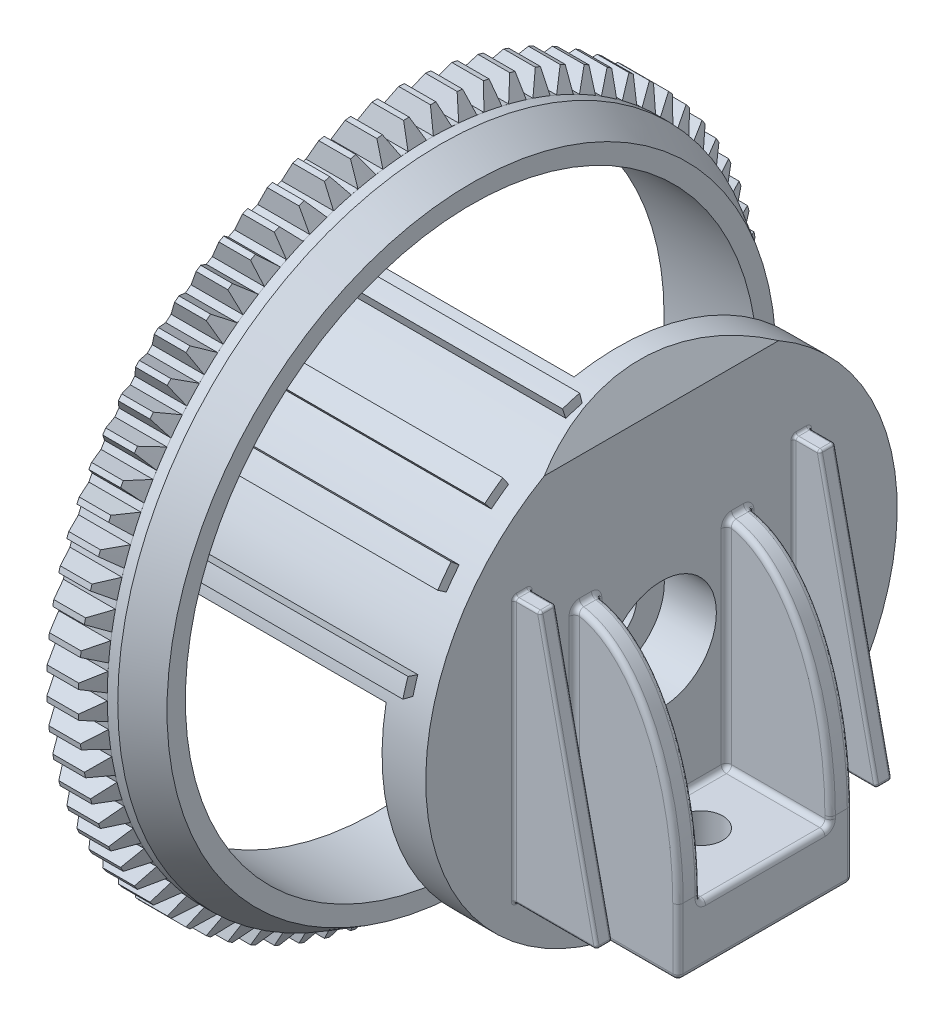
from build123d import *
from build123d.topology import SkipClean

# Parameters (mm, degrees)
SKETCH1_R               = 22.65
BOSS_EXTRUDE1_DEPTH     = 4.2
SKETCH2_R               = 20.05
CUT_EXTRUDE1_DEPTH      = 2.25
FILLET1_R               = 0.3
SKETCH4_R               = 7.5
BOSS_EXTRUDE3_DEPTH     = 17.45
FILLET2_R               = 2
SKETCH5_R               = 5.55
CUT_EXTRUDE3_DEPTH      = 12.26
SKETCH3_R               = 2.625
CUT_EXTRUDE2_DEPTH      = 11.25
SKETCH6_R               = 5.275
CUT_EXTRUDE5_DEPTH      = 5
BOSS_EXTRUDE4_START     = 12.26
BOSS_EXTRUDE4_DEPTH     = 12.26
BOSS_EXTRUDE5_DEPTH     = 9.97
FILLET3_START           = -8.385
FILLET3_DEPTH           = 16.77
SKETCH9_R               = 2.045
CUT_EXTRUDE6_DEPTH      = 9.97
FILLET4_R               = 0.5
CUT_EXTRUDE7_DEPTH      = 19.97
CUT_EXTRUDE7_DEPTH_BACK = 19.97
BOSS_EXTRUDE6_START     = 20.3
BOSS_EXTRUDE6_DEPTH     = 20.3
SKETCH12_W              = 1.5
SKETCH12_H              = 25.4
BOSS_EXTRUDE7_DEPTH     = 8
CUT_EXTRUDE8_DEPTH      = 4
FILLET5_R               = 0.25
BOSS_EXTRUDE8_START     = 5
BOSS_EXTRUDE8_DEPTH     = 5
SKETCH24_R              = 30.997182168
SKETCH24_R_2            = 27.5
BOSS_EXTRUDE9_DEPTH     = 4
CHAMFER1_SIZE           = 3
CHAMFER1_SIZE2          = 1.732050808


with BuildPart() as part:
    # Sketch1 → Boss-Extrude1 (new body)
    with BuildSketch(Plane(origin=(0, 0, 0), x_dir=(0, 0, -1), z_dir=(1, 0, 0))):
        Circle(SKETCH1_R)
    extrude(amount=BOSS_EXTRUDE1_DEPTH)

    # Sketch2 → Cut-Extrude1 (cut)
    with BuildSketch(Plane.ZY):
        Circle(SKETCH2_R)
    extrude(amount=-CUT_EXTRUDE1_DEPTH, mode=Mode.SUBTRACT)

    # Fillet1
    fillet1_edges = [part.edges().sort_by_distance(p)[0] for p in [
        (2.25, 0, -20.05),
        (0, 0, -20.05),
    ]]
    fillet(fillet1_edges, radius=FILLET1_R)

    # Sketch4 → Boss-Extrude3 (add)
    with BuildSketch(Plane.ZY.offset(-2.25)):
        Circle(SKETCH4_R)
    extrude(amount=BOSS_EXTRUDE3_DEPTH)

    # Fillet2
    fillet2_edges = [part.edges().sort_by_distance(p)[0] for p in [
        (2.25, 0, -7.5),
    ]]
    fillet(fillet2_edges, radius=FILLET2_R)

    # Sketch5 → Cut-Extrude3 (cut)
    with BuildSketch(Plane.ZY.offset(15.2)):
        Circle(SKETCH5_R)
    extrude(amount=-CUT_EXTRUDE3_DEPTH, mode=Mode.SUBTRACT)

    # Sketch3 → Cut-Extrude2 (cut)
    with BuildSketch(Plane(origin=(4.2, 0, 0), x_dir=(0, 0, -1), z_dir=(1, 0, 0))):
        Circle(SKETCH3_R)
    extrude(amount=-CUT_EXTRUDE2_DEPTH, mode=Mode.SUBTRACT)

    # Sketch6 → Cut-Extrude5 (cut)
    with BuildSketch(Plane(origin=(4.2, 0, 0), x_dir=(0, 0, -1), z_dir=(1, 0, 0))):
        Circle(SKETCH6_R)
    extrude(amount=-CUT_EXTRUDE5_DEPTH, mode=Mode.SUBTRACT)

    # Sketch7 → Boss-Extrude4 (add)
    with BuildSketch(Plane.ZY.offset(2.94).offset(BOSS_EXTRUDE4_START)):
        with BuildLine():
            Line((-2.698147513, -4.85), (2.698147513, -4.85))
            ThreePointArc((2.698147513, -4.85), (0, -5.55), (-2.698147513, -4.85))
        make_face()
        with BuildLine():
            Line((2.698147513, 4.85), (-2.698147513, 4.85))
            ThreePointArc((-2.698147513, 4.85), (0, 5.55), (2.698147513, 4.85))
        make_face()
    extrude(amount=-BOSS_EXTRUDE4_DEPTH)

    # Sketch8 → Boss-Extrude5 (add)
    with BuildSketch(Plane(origin=(4.2, 0, 0), x_dir=(0, 0, -1), z_dir=(1, 0, 0))):
        Polygon((8.385, -18.97), (-8.385, -18.97), (-8.385, 7.34), (-6.235, 7.34), (-6.235, -13.37), (6.235, -13.37), (6.235, 7.34), (8.385, 7.34), align=None)
    extrude(amount=BOSS_EXTRUDE5_DEPTH)

    # Fillet3: read off the stored shape, not the designer's step
    # Fillet3 outline → Fillet3 (cut)
    with BuildSketch(Plane.XY.offset(FILLET3_START)):
        with BuildLine():
            Line((14.17, 7.34), (4.2, 7.34))
            add(Edge.make_bspline(
                [(4.2, 7.34), (14.17, 6.575053386), (14.17, -12.601391626)],
                knots=[0, 0, 0, 1, 1, 1], degree=2, weights=[1, 0.733655232, 1]))
            Line((14.17, -12.601391626), (14.17, 7.34))
        make_face()
    extrude(amount=FILLET3_DEPTH, mode=Mode.SUBTRACT)

    # Sketch9 → Cut-Extrude6 (cut)
    with BuildSketch(Plane.XZ.offset(18.97)):
        with Locations(Location((8.035, 0, 0), (0, 0, 270))):
            Circle(SKETCH9_R)
    extrude(amount=-CUT_EXTRUDE6_DEPTH, mode=Mode.SUBTRACT)

    # Fillet4
    fillet4_edges = [part.edges().sort_by_distance(p)[0] for p in [
        (4.2, 7.34, -7.31),
        (4.2, -18.97, 0),
        (4.2, 7.34, 7.31),
        (9.185, -13.37, 6.235),
        (12.196725877, -0.808020122, 6.235),
        (4.2, -3.015, 6.235),
        (9.185, -13.37, -6.235),
        (4.2, -3.015, -6.235),
        (12.196725877, -0.808020122, -6.235),
        (9.185, -18.97, -8.385),
        (12.196714654, -0.807990396, -8.385),
        (4.2, -5.815, -8.385),
        (9.185, -18.97, 8.385),
        (4.2, -5.815, 8.385),
        (12.196714654, -0.807990396, 8.385),
        (14.17, -18.97, 0),
        (14.17, -15.785695813, 8.385),
        (14.17, -12.985695813, 6.235),
        (14.17, -13.37, 0),
        (14.17, -12.985695813, -6.235),
        (14.17, -15.785695813, -8.385),
        (4.2, -13.37, 0),
    ]]
    fillet(fillet4_edges, radius=FILLET4_R)

    # Sketch10 → Cut-Extrude7 (cut, two sides: drawn at the far end of the back side and taken through both)
    with BuildSketch(Plane.XY.offset(-CUT_EXTRUDE7_DEPTH_BACK)):
        Polygon((4.2, 22.65), (4.2, 19.65), (2.1, 22.65), align=None)
    extrude(amount=CUT_EXTRUDE7_DEPTH + CUT_EXTRUDE7_DEPTH_BACK, mode=Mode.SUBTRACT)

    # Sketch11 → Boss-Extrude6 (add)
    with SkipClean():  # the faces are left unmerged after this step: merging them gives an invalid solid
        with BuildSketch(Plane.ZY.offset(-2.25).offset(BOSS_EXTRUDE6_START)):
            with BuildLine():
                Line((21.930213837, 5.664646596), (22.898435199, 5.914741368))
                ThreePointArc((22.898435199, 5.914741368), (22.668143265, 6.743721592), (22.407850884, 7.563776751))
                Line((22.407850884, 7.563776751), (21.460373046, 7.243955324))
                ThreePointArc((21.460373046, 7.243955324), (20.279979501, 10.086869258), (18.725016199, 12.743479444))
                Line((18.725016199, 12.743479444), (19.551727731, 13.306105468))
                ThreePointArc((19.551727731, 13.306105468), (18.925107529, 14.183187407), (18.259172679, 15.03080547))
                Line((18.259172679, 15.03080547), (17.487114637, 14.395253442))
                ThreePointArc((17.487114637, 14.395253442), (16.015968594, 16.015968594), (14.395253442, 17.487114637))
                Line((14.395253442, 17.487114637), (15.03080547, 18.259172679))
                ThreePointArc((15.03080547, 18.259172679), (14.183187407, 18.925107529), (13.306105468, 19.551727731))
                Line((13.306105468, 19.551727731), (12.743479444, 18.725016199))
                ThreePointArc((12.743479444, 18.725016199), (10.086869258, 20.279979501), (7.243955324, 21.460373046))
                Line((7.243955324, 21.460373046), (7.563776751, 22.407850884))
                ThreePointArc((7.563776751, 22.407850884), (6.743721592, 22.668143265), (5.914741368, 22.898435199))
                Line((5.914741368, 22.898435199), (5.664646596, 21.930213837))
                ThreePointArc((5.664646596, 21.930213837), (4.935032061, 22.105835396), (4.2, 22.25718985))
                Line((4.2, 22.25718985), (3.272847682, 17.343902907))
                ThreePointArc((3.272847682, 17.343902907), (12.480434688, 12.480434688), (17.343902907, 3.272847682))
                Line((17.343902907, 3.272847682), (22.25718985, 4.2))
                ThreePointArc((22.25718985, 4.2), (22.105835396, 4.935032061), (21.930213837, 5.664646596))
            make_face()
        extrude(amount=-BOSS_EXTRUDE6_DEPTH)
    add(part.part.scale(1), mode=Mode.REPLACE)  # the faces are merged on a copy

    # Sketch12 → Boss-Extrude7 (add)
    with BuildSketch(Plane(origin=(4.2, 0, 0), x_dir=(0, 0, -1), z_dir=(1, 0, 0))):
        with Locations((13.435, -1.712172826)):
            Rectangle(SKETCH12_W, SKETCH12_H)
    boss_extrude7 = extrude(amount=BOSS_EXTRUDE7_DEPTH)

    # Sketch13 → Cut-Extrude8 (cut)
    with BuildSketch(Plane(origin=(0, 0, -14.185), x_dir=(-1, 0, 0), z_dir=(0, 0, -1))):
        Polygon((-6.7, 10.987827174), (-12.2, -14.412172826), (-12.2, 10.987827174), align=None)
    cut_extrude8 = extrude(amount=-CUT_EXTRUDE8_DEPTH, mode=Mode.SUBTRACT)

    # Mirror1: Boss-Extrude7, Cut-Extrude8 across plane
    add(boss_extrude7.mirror(Plane.XY))
    add(cut_extrude8.mirror(Plane.XY), mode=Mode.SUBTRACT)

    # Fillet5
    fillet5_edges = [part.edges().sort_by_distance(p)[0] for p in [
        (4.2, -14.412172826, -13.435),
        (8.2, -14.412172826, -12.685),
        (4.2, -1.712172826, -14.185),
        (8.2, -14.412172826, -14.185),
        (4.2, 10.987827174, -13.435),
        (4.2, -1.712172826, -12.685),
        (12.2, -14.412172826, -13.435),
        (5.45, 10.987827174, -12.685),
        (5.45, 10.987827174, -14.185),
        (9.45, -1.712172826, -12.685),
        (6.7, 10.987827174, -13.435),
        (9.45, -1.712172826, -14.185),
        (12.2, -14.412172826, 13.435),
        (8.2, -14.412172826, 14.185),
        (8.2, -14.412172826, 12.685),
        (4.2, -14.412172826, 13.435),
        (4.2, -1.712172826, 14.185),
        (4.2, 10.987827174, 13.435),
        (4.2, -1.712172826, 12.685),
        (5.45, 10.987827174, 14.185),
        (5.45, 10.987827174, 12.685),
        (6.7, 10.987827174, 13.435),
        (9.45, -1.712172826, 12.685),
        (9.45, -1.712172826, 14.185),
    ]]
    fillet(fillet5_edges, radius=FILLET5_R)

    # Sketch14 → Boss-Extrude8 (add)
    with SkipClean():  # the faces are left unmerged after this step: merging them gives an invalid solid
        with BuildSketch(Plane.ZY.offset(18.05).offset(BOSS_EXTRUDE8_START)):
            Polygon((-29.376333174, 9.897931615), (-30.863257239, 11.104024162), (-30.680091743, 11.600515964), (-28.766131363, 11.551955999), (-28.509192978, 12.172260132), (-29.896904422, 13.491297415), (-29.675349267, 13.9718877), (-27.771098959, 13.773309829), (-27.466284128, 14.371542617), (-28.746227248, 15.795392334), (-28.487648394, 16.257118102), (-26.604848494, 15.909746623), (-26.254036502, 16.482219763), (-27.418320024, 18.002103406), (-27.124311696, 18.442117965), (-25.274570292, 17.948094538), (-24.879924011, 18.491278544), (-25.921369739, 20.097825525), (-25.593744596, 20.513416038), (-23.788465959, 19.875786483), (-23.352418516, 20.386332443), (-24.26460559, 22.069637866), (-23.905383551, 22.458242079), (-22.155697823, 21.680937594), (-21.680937594, 22.155697823), (-22.458242079, 23.905383551), (-22.069637866, 24.26460559), (-20.386332443, 23.352418516), (-19.875786483, 23.788465959), (-20.513416038, 25.593744596), (-20.097825525, 25.921369739), (-18.491278544, 24.879924011), (-17.948094538, 25.274570292), (-18.442117965, 27.124311696), (-18.002103406, 27.418320024), (-16.482219763, 26.254036502), (-15.909746623, 26.604848494), (-16.257118102, 28.487648394), (-15.795392334, 28.746227248), (-14.371542617, 27.466284128), (-13.773309829, 27.771098959), (-13.9718877, 29.675349267), (-13.491297415, 29.896904422), (-12.172260132, 28.509192978), (-11.551955999, 28.766131363), (-11.600515964, 30.680091743), (-11.104024162, 30.863257239), (-9.897931615, 29.376333174), (-9.25938052, 29.583811002), (-9.15762319, 31.495681252), (-8.648290907, 31.639327812), (-7.562579059, 30.062358507), (-6.909717881, 30.219096608), (-6.658270623, 32.117089412), (-6.139238063, 32.220331407), (-5.180600688, 30.563039402), (-4.517454533, 30.668071435), (-4.117867604, 32.540485036), (-3.592334775, 32.602685946), (-2.76668219, 30.875288997), (-2.097339576, 30.927967403), (-1.552076562, 32.763257749), (-1.023283548, 32.784034083), (-0.335706178, 30.997182168), (0.335706178, 30.997182168), (1.023283548, 32.784034083), (1.552076562, 32.763257749), (2.097339576, 30.927967403), (2.76668219, 30.875288997), (3.592334775, 32.602685946), (4.117867604, 32.540485036), (4.517454533, 30.668071435), (5.180600688, 30.563039402), (6.139238063, 32.220331407), (6.658270623, 32.117089412), (6.909717881, 30.219096608), (7.562579059, 30.062358507), (8.648290907, 31.639327812), (9.15762319, 31.495681252), (9.25938052, 29.583811002), (9.897931615, 29.376333174), (11.104024162, 30.863257239), (11.600515964, 30.680091743), (11.551955999, 28.766131363), (12.172260132, 28.509192978), (13.491297415, 29.896904422), (13.9718877, 29.675349267), (13.773309829, 27.771098959), (14.371542617, 27.466284128), (15.795392334, 28.746227248), (16.257118102, 28.487648394), (15.909746623, 26.604848494), (16.482219763, 26.254036502), (18.002103406, 27.418320024), (18.442117965, 27.124311696), (17.948094538, 25.274570292), (18.491278544, 24.879924011), (20.097825525, 25.921369739), (20.513416038, 25.593744596), (19.875786483, 23.788465959), (20.386332443, 23.352418516), (22.069637866, 24.26460559), (22.458242079, 23.905383551), (21.680937594, 22.155697823), (22.155697823, 21.680937594), (23.905383551, 22.458242079), (24.26460559, 22.069637866), (23.352418516, 20.386332443), (23.788465959, 19.875786483), (25.593744596, 20.513416038), (25.921369739, 20.097825525), (24.879924011, 18.491278544), (25.274570292, 17.948094538), (27.124311696, 18.442117965), (27.418320024, 18.002103406), (26.254036502, 16.482219763), (26.604848494, 15.909746623), (28.487648394, 16.257118102), (28.746227248, 15.795392334), (27.466284128, 14.371542617), (27.771098959, 13.773309829), (29.675349267, 13.9718877), (29.896904422, 13.491297415), (28.509192978, 12.172260132), (28.766131363, 11.551955999), (30.680091743, 11.600515964), (30.863257239, 11.104024162), (29.376333174, 9.897931615), (29.583811002, 9.25938052), (31.495681252, 9.15762319), (31.639327812, 8.648290907), (30.062358507, 7.562579059), (30.219096608, 6.909717881), (32.117089412, 6.658270623), (32.220331407, 6.139238063), (30.563039402, 5.180600688), (30.668071435, 4.517454533), (32.540485036, 4.117867604), (32.602685946, 3.592334775), (30.875288997, 2.76668219), (30.927967403, 2.097339576), (32.763257749, 1.552076562), (32.784034083, 1.023283548), (30.997182168, 0.335706178), (30.997182168, -0.335706178), (32.784034083, -1.023283548), (32.763257749, -1.552076562), (30.927967403, -2.097339576), (30.875288997, -2.76668219), (32.602685946, -3.592334775), (32.540485036, -4.117867604), (30.668071435, -4.517454533), (30.563039402, -5.180600688), (32.220331407, -6.139238063), (32.117089412, -6.658270623), (30.219096608, -6.909717881), (30.062358507, -7.562579059), (31.639327812, -8.648290907), (31.495681252, -9.15762319), (29.583811002, -9.25938052), (29.376333174, -9.897931615), (30.863257239, -11.104024162), (30.680091743, -11.600515964), (28.766131363, -11.551955999), (28.509192978, -12.172260132), (29.896904422, -13.491297415), (29.675349267, -13.9718877), (27.771098959, -13.773309829), (27.466284128, -14.371542617), (28.746227248, -15.795392334), (28.487648394, -16.257118102), (26.604848494, -15.909746623), (26.254036502, -16.482219763), (27.418320024, -18.002103406), (27.124311696, -18.442117965), (25.274570292, -17.948094538), (24.879924011, -18.491278544), (25.921369739, -20.097825525), (25.593744596, -20.513416038), (23.788465959, -19.875786483), (23.352418516, -20.386332443), (24.26460559, -22.069637866), (23.905383551, -22.458242079), (22.155697823, -21.680937594), (21.680937594, -22.155697823), (22.458242079, -23.905383551), (22.069637866, -24.26460559), (20.386332443, -23.352418516), (19.875786483, -23.788465959), (20.513416038, -25.593744596), (20.097825525, -25.921369739), (18.491278544, -24.879924011), (17.948094538, -25.274570292), (18.442117965, -27.124311696), (18.002103406, -27.418320024), (16.482219763, -26.254036502), (15.909746623, -26.604848494), (16.257118102, -28.487648394), (15.795392334, -28.746227248), (14.371542617, -27.466284128), (13.773309829, -27.771098959), (13.9718877, -29.675349267), (13.491297415, -29.896904422), (12.172260132, -28.509192978), (11.551955999, -28.766131363), (11.600515964, -30.680091743), (11.104024162, -30.863257239), (9.897931615, -29.376333174), (9.25938052, -29.583811002), (9.15762319, -31.495681252), (8.648290907, -31.639327812), (7.562579059, -30.062358507), (6.909717881, -30.219096608), (6.658270623, -32.117089412), (6.139238063, -32.220331407), (5.180600688, -30.563039402), (4.517454533, -30.668071435), (4.117867604, -32.540485036), (3.592334775, -32.602685946), (2.76668219, -30.875288997), (2.097339576, -30.927967403), (1.552076562, -32.763257749), (1.023283548, -32.784034083), (0.335706178, -30.997182168), (-0.335706178, -30.997182168), (-1.023283548, -32.784034083), (-1.552076562, -32.763257749), (-2.097339576, -30.927967403), (-2.76668219, -30.875288997), (-3.592334775, -32.602685946), (-4.117867604, -32.540485036), (-4.517454533, -30.668071435), (-5.180600688, -30.563039402), (-6.139238063, -32.220331407), (-6.658270623, -32.117089412), (-6.909717881, -30.219096608), (-7.562579059, -30.062358507), (-8.648290907, -31.639327812), (-9.15762319, -31.495681252), (-9.25938052, -29.583811002), (-9.897931615, -29.376333174), (-11.104024162, -30.863257239), (-11.600515964, -30.680091743), (-11.551955999, -28.766131363), (-12.172260132, -28.509192978), (-13.491297415, -29.896904422), (-13.9718877, -29.675349267), (-13.773309829, -27.771098959), (-14.371542617, -27.466284128), (-15.795392334, -28.746227248), (-16.257118102, -28.487648394), (-15.909746623, -26.604848494), (-16.482219763, -26.254036502), (-18.002103406, -27.418320024), (-18.442117965, -27.124311696), (-17.948094538, -25.274570292), (-18.491278544, -24.879924011), (-20.097825525, -25.921369739), (-20.513416038, -25.593744596), (-19.875786483, -23.788465959), (-20.386332443, -23.352418516), (-22.069637866, -24.26460559), (-22.458242079, -23.905383551), (-21.680937594, -22.155697823), (-22.155697823, -21.680937594), (-23.905383551, -22.458242079), (-24.26460559, -22.069637866), (-23.352418516, -20.386332443), (-23.788465959, -19.875786483), (-25.593744596, -20.513416038), (-25.921369739, -20.097825525), (-24.879924011, -18.491278544), (-25.274570292, -17.948094538), (-27.124311696, -18.442117965), (-27.418320024, -18.002103406), (-26.254036502, -16.482219763), (-26.604848494, -15.909746623), (-28.487648394, -16.257118102), (-28.746227248, -15.795392334), (-27.466284128, -14.371542617), (-27.771098959, -13.773309829), (-29.675349267, -13.9718877), (-29.896904422, -13.491297415), (-28.509192978, -12.172260132), (-28.766131363, -11.551955999), (-30.680091743, -11.600515964), (-30.863257239, -11.104024162), (-29.376333174, -9.897931615), (-29.583811002, -9.25938052), (-31.495681252, -9.15762319), (-31.639327812, -8.648290907), (-30.062358507, -7.562579059), (-30.219096608, -6.909717881), (-32.117089412, -6.658270623), (-32.220331407, -6.139238063), (-30.563039402, -5.180600688), (-30.668071435, -4.517454533), (-32.540485036, -4.117867604), (-32.602685946, -3.592334775), (-30.875288997, -2.76668219), (-30.927967403, -2.097339576), (-32.763257749, -1.552076562), (-32.784034083, -1.023283548), (-30.997182168, -0.335706178), (-30.997182168, 0.335706178), (-32.784034083, 1.023283548), (-32.763257749, 1.552076562), (-30.927967403, 2.097339576), (-30.875288997, 2.76668219), (-32.602685946, 3.592334775), (-32.540485036, 4.117867604), (-30.668071435, 4.517454533), (-30.563039402, 5.180600688), (-32.220331407, 6.139238063), (-32.117089412, 6.658270623), (-30.219096608, 6.909717881), (-30.062358507, 7.562579059), (-31.639327812, 8.648290907), (-31.495681252, 9.15762319), (-29.583811002, 9.25938052), align=None)
            with BuildLine():
                Line((17.343902907, 3.272847682), (27.023078184, 5.099337748))
                ThreePointArc((27.023078184, 5.099337748), (-19.445436483, -19.445436483), (5.099337748, 27.023078184))
                Line((5.099337748, 27.023078184), (3.272847682, 17.343902907))
                ThreePointArc((3.272847682, 17.343902907), (12.480434688, 12.480434688), (17.343902907, 3.272847682))
            make_face(mode=Mode.SUBTRACT)
        extrude(amount=-BOSS_EXTRUDE8_DEPTH)

    # Sketch21 → Cut-Revolve1 (revolve, cut)
    with SkipClean():  # the faces are left unmerged after this step: merging them gives an invalid solid
        with BuildSketch(Plane.XY, mode=Mode.PRIVATE) as cut_revolve1_sk:
            Polygon((-18.05, 30.997182168), (-19.082046592, 32.900600951), (-18.05, 32.900600951), align=None)
            Polygon((-23.05, 30.997182168), (-22.017953408, 32.900600951), (-23.05, 32.900600951), align=None)
        revolve(cut_revolve1_sk.sketch.rotate(Axis((-19.082046592, 0, 0), (1, 0, 0)), 79.31376961), axis=Axis((-19.082046592, 0, 0), (1, 0, 0)), mode=Mode.SUBTRACT)

    # Sketch24 → Boss-Extrude9 (add)
    with SkipClean():  # the faces are left unmerged after this step: merging them gives an invalid solid
        with BuildSketch(Plane(origin=(-18.05, 0, 0), x_dir=(0, 0, -1), z_dir=(1, 0, 0))):
            Circle(SKETCH24_R)
            Circle(SKETCH24_R_2, mode=Mode.SUBTRACT)
        extrude(amount=BOSS_EXTRUDE9_DEPTH)

    # Chamfer1
    chamfer1_edges = [part.edges().sort_by_distance(p)[0] for p in [
        (-14.05, 0, 30.997182168),
    ]]
    chamfer1_side = [part.faces().sort_by_distance(p)[0] for p in [
        (-16.05, 0, 30.997182168),
    ]]
    chamfer(chamfer1_edges, length=CHAMFER1_SIZE, length2=CHAMFER1_SIZE2, reference=chamfer1_side[0])


solid = part.part
